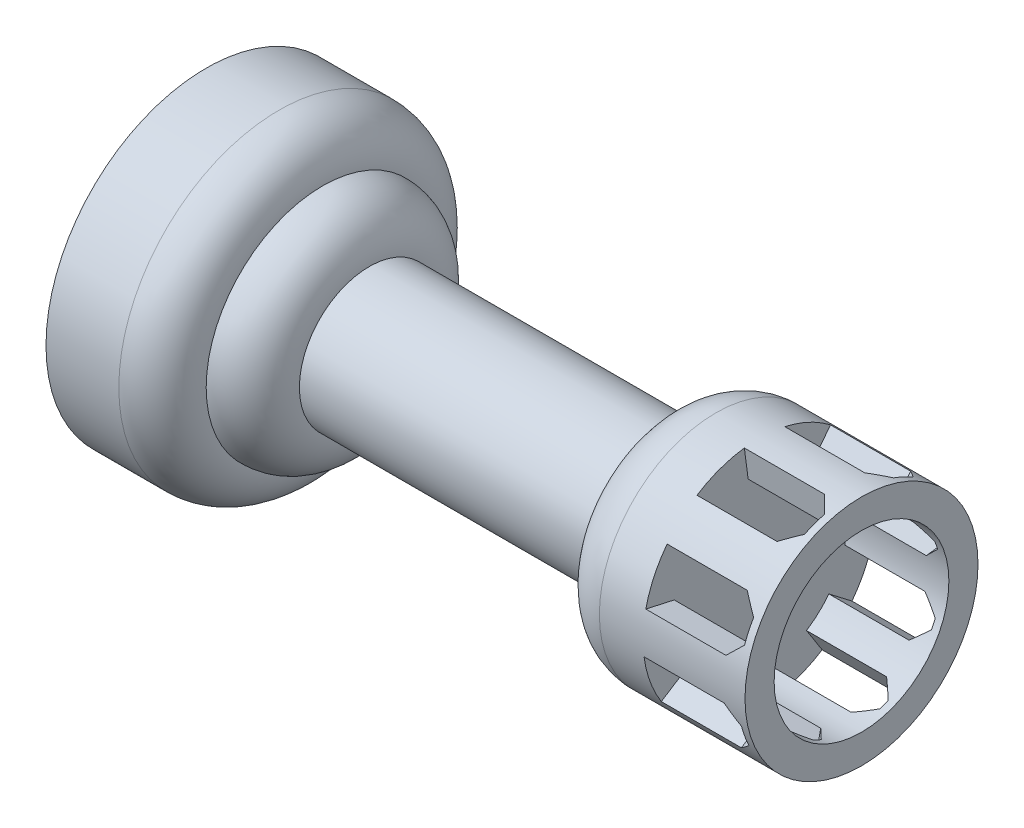
from build123d import *

# Parameters (mm, degrees)
SKETCH_2_R               = 10
CUT_EXTRUDE_1_DEPTH      = 2.5
CUT_EXTRUDE_START        = 6.5
CUT_EXTRUDE_2_DEPTH      = 6.5
PATTERN_CIRCULAR_1_COUNT = 8
CHAMFER_4_SIZE           = 1
CHAMFER_5_SIZE           = 1
CHAMFER_6_SIZE           = 1


with BuildPart() as part:
    # Эскиз1 → Повернуть11 (revolve)
    with BuildSketch(Plane(origin=(0, 0, 0), x_dir=(1, 0, 0), z_dir=(0, 1, 0))):
        with BuildLine():
            Line((0, 11), (0, 0))
            Line((0, 0), (5, 0))
            Line((5, 0), (5, 3))
            Line((5, 3), (8, 3))
            ThreePointArc((8, 3), (10.2627417, 3.9372583), (11.2, 6.2))
            Line((11.2, 6.2), (31.465178427, 6.2))
            ThreePointArc((31.465178427, 6.2), (32.615940251, 3.918829982), (35, 3))
            Line((35, 3), (45, 3))
            Line((45, 3), (45, 5))
            Line((45, 5), (38, 5))
            Line((38, 5), (38, 11))
            Line((38, 11), (0, 11))
        make_face()
    revolve(axis=Axis((0, 0, -11), (1, 0, 0)))

    # Эскиз2 → Вырез-Вытянуть1 (cut)
    with BuildSketch(Plane.ZY):
        with Locations((-11, 0)):
            Circle(SKETCH_2_R)
    extrude(amount=-CUT_EXTRUDE_1_DEPTH, mode=Mode.SUBTRACT)

    # Эскиз6 → Вырез-Вытянуть2 (cut)
    with BuildSketch(Plane(origin=(38, 0, 0), x_dir=(0, 0, -1), z_dir=(1, 0, 0)).offset(CUT_EXTRUDE_START)):
        with BuildLine():
            Line((4.653173278, 4.870091432), (6.239879958, 3.652568574))
            ThreePointArc((6.239879958, 3.652568574), (5.562153278, 2.53570957), (5.142223957, 1.298637684))
            Line((5.142223957, 1.298637684), (3.189631943, 1.731516912))
            ThreePointArc((3.189631943, 1.731516912), (3.749537704, 3.380946094), (4.653173278, 4.870091432))
        make_face()
    cut_extrude_2 = extrude(amount=-CUT_EXTRUDE_2_DEPTH, mode=Mode.SUBTRACT)

    # Круговой массив1: Вырез-Вытянуть2 ×8 about axis
    pattern_circular_1_axis = Axis((45, 0, -11), (-1, 0, 0))
    for i in range(1, PATTERN_CIRCULAR_1_COUNT):
        add(cut_extrude_2.rotate(pattern_circular_1_axis, i * 360 / PATTERN_CIRCULAR_1_COUNT), mode=Mode.SUBTRACT)

    # Эскиз1<12> → Повернуть12 (revolve)
    with BuildSketch(Plane(origin=(0, 0, 0), x_dir=(1, 0, 0), z_dir=(0, 1, 0))):
        with BuildLine():
            Line((5, 3), (5, 0))
            ThreePointArc((5, 0), (7.121320344, 0.878679656), (8, 3))
            Line((8, 3), (5, 3))
        make_face()
    revolve(axis=Axis((0, 0, -11), (1, 0, 0)))

    # Фаска4
    chamfer_4_edges = [part.edges().sort_by_distance(p)[0] for p in [
        (44.5, 3.761097258, -16.903740121),
        (44.5, 0.913683346, -17.94011403),
    ]]
    chamfer(chamfer_4_edges, length=CHAMFER_4_SIZE)

    # Фаска5
    chamfer_5_edges = [part.edges().sort_by_distance(p)[0] for p in [
        (44.5, 5.553473382, -15.261330003),
        (44.5, 6.83407205, -12.515077298),
    ]]
    chamfer(chamfer_5_edges, length=CHAMFER_5_SIZE)

    # Фаска6
    chamfer_6_edges = [part.edges().sort_by_distance(p)[0] for p in [
        (44.5, -1.515077298, -17.83407205),
        (44.5, -4.261330003, -16.553473382),
        (44.5, -6.94011403, -11.913683346),
        (44.5, -5.903740121, -14.761097258),
        (44.5, -6.83407205, -9.484922702),
        (44.5, -5.553473382, -6.738669997),
        (44.5, -3.761097258, -5.096259879),
        (44.5, -0.913683346, -4.05988597),
        (44.5, 1.515077298, -4.16592795),
        (44.5, 4.261330003, -5.446526618),
        (44.5, 5.903740121, -7.238902742),
        (44.5, 6.94011403, -10.086316654),
    ]]
    chamfer(chamfer_6_edges, length=CHAMFER_6_SIZE)


solid = part.part
